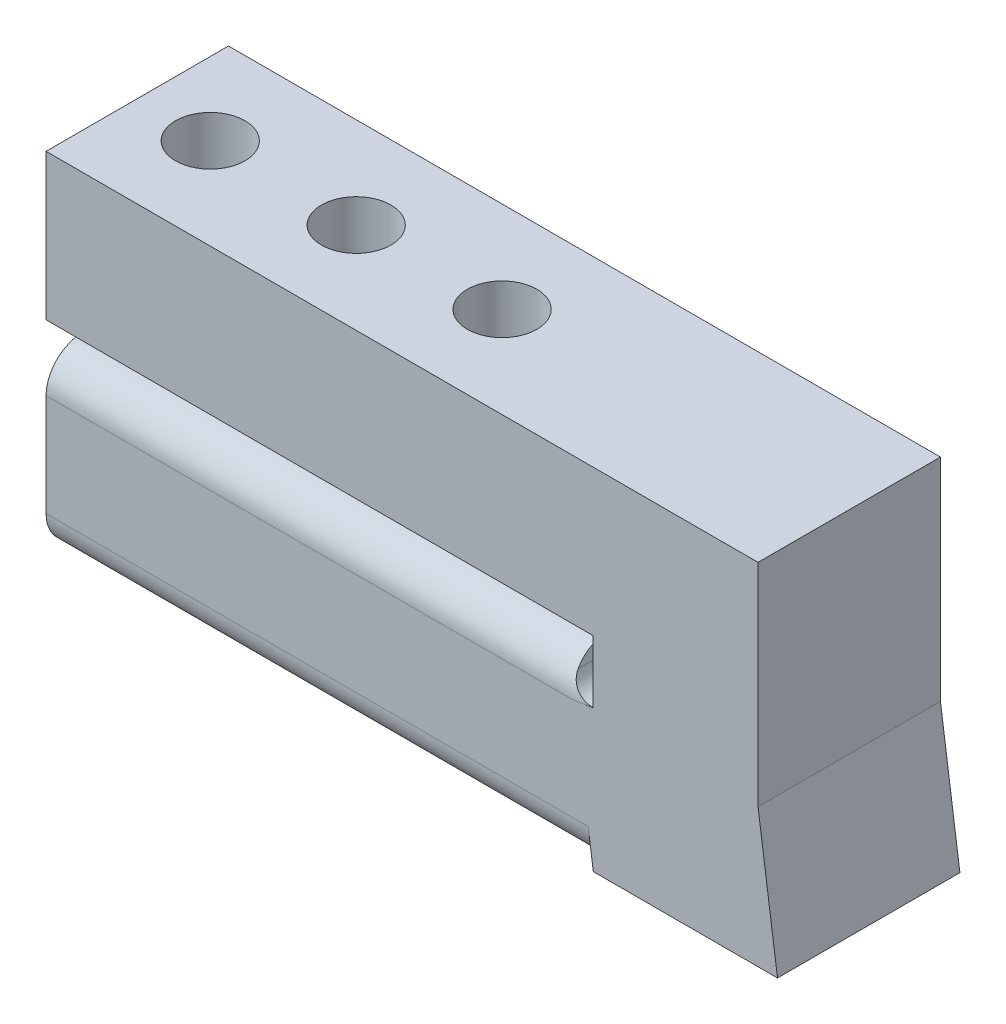
from build123d import *

# Parameters (mm, degrees)
SKETCH1_W                = 50
SKETCH1_H                = 25
BOSS_EXTRUDE1_DEPTH      = 25
BOSS_EXTRUDE2_DEPTH      = 25
SKETCH4_R                = 6.625
CUT_EXTRUDE1_DEPTH       = 75
SKETCH9_R                = 3.1
CUT_EXTRUDE6_DEPTH       = 116.938210964
FILLET3_R                = 5
FILLET5_R                = 3
SKETCH10_W               = 47.732743957
SKETCH10_H               = 107.667843513
CUT_EXTRUDE7_DEPTH       = 100
SKETCH11_W               = 28.236029243
SKETCH11_H               = 25
CUT_EXTRUDE8_DEPTH       = 111.285013225
SKETCH12_W               = 27.477268163
SKETCH12_H               = 27.699456316
CUT_EXTRUDE9_DEPTH       = 5
BODY_MOVE_COPY1_ANGLE    = 8
SKETCH13_W               = 22.608001889
SKETCH13_H               = 25
BOSS_EXTRUDE3_DEPTH      = 29
SKETCH14_W               = 25
SKETCH14_H               = 20
BOSS_EXTRUDE4_DEPTH      = 74.967411564
CUT_EXTRUDE10_DEPTH      = 113.041997451
CUT_EXTRUDE10_DEPTH_BACK = 113.041997451
SKETCH15_R               = 4.7625
SKETCH15_R_2             = 3.1


with BuildPart() as part:
    # Sketch1 → Boss-Extrude1 (new body)
    with BuildSketch(Plane.XY):
        Rectangle(SKETCH1_W, SKETCH1_H)
    extrude(amount=BOSS_EXTRUDE1_DEPTH)

    # Sketch3 → Boss-Extrude2 (add)
    with BuildSketch(Plane.XY.offset(25)):
        Polygon((-25, 12.5), (-99.270105156, 22.937982572), (-95.929950733, 46.704416222), (-25, 36.73586174), (-25, 31.73586174), (25, 31.73586174), (25, 36.73586174), (95.929950733, 46.704416222), (99.270105156, 22.937982572), (25, 12.5), align=None)
    extrude(amount=-BOSS_EXTRUDE2_DEPTH)

    # Sketch4 → Cut-Extrude1 (cut)
    with BuildSketch(Plane(origin=(-100.508609829, 14.12556392, 0), x_dir=(0, 0, 1), z_dir=(-0.9902680687415705, 0.13917310096006502, 0))):
        with Locations(Location((12.5, 20.899023335, 0), (0, 0, 270))):
            Circle(SKETCH4_R)
    cut_extrude1 = extrude(amount=-CUT_EXTRUDE1_DEPTH, mode=Mode.SUBTRACT)

    # Mirror1: Cut-Extrude1 across plane
    add(cut_extrude1.mirror(Plane(origin=(0, 0, 0), x_dir=(0, 0, 1), z_dir=(1, 0, 0))), mode=Mode.SUBTRACT)

    # Sketch9 → Cut-Extrude6 (cut, through all)
    with BuildSketch(Plane(origin=(4.578659096, 32.578852302, 0), x_dir=(0.9902680687415703, -0.1391731009600656, 0), z_dir=(0.1391731009600656, 0.9902680687415703, 0))):
        with Locations(Location((-91.496365481, -12.5, 0), (0, 0, 180))):
            Circle(SKETCH9_R)
        with Locations(Location((-71.496365481, -12.5, 0), (0, 0, 180))):
            Circle(SKETCH9_R)
        with Locations(Location((-51.496365481, -12.5, 0), (0, 0, 180))):
            Circle(SKETCH9_R)
    extrude(amount=-CUT_EXTRUDE6_DEPTH, mode=Mode.SUBTRACT)

    # Fillet3
    # the kernel refuses this fillet: 5 mm, written as the material it takes off along each edge
    with BuildSketch(Plane(origin=(111.648456015, 24.677646334, 25), x_dir=(-0.13917310096006577, 0.9902680687415704, 0), z_dir=(-0.9902680687415703, -0.13917310096006574, 0))) as fillet3_piece_1_section:
        with BuildLine():
            CenterArc((FILLET3_R, FILLET3_R), FILLET3_R, 180, 90)
            Line((0, FILLET3_R), (0, 0))
            Line((0, 0), (FILLET3_R, 0))
        make_face()
    fillet3_piece_1 = extrude(amount=100, mode=Mode.PRIVATE)
    fillet3_piece_1 = split(fillet3_piece_1, bisect_by=Plane(origin=(25, 18.834233779, 23.882189323), z_dir=(1, 0, 0)), keep=Keep.TOP, mode=Mode.PRIVATE)
    add(fillet3_piece_1, mode=Mode.SUBTRACT)
    with BuildSketch(Plane(origin=(12.621649141, 34.996197978, 25), x_dir=(0.13917310096006597, -0.9902680687415704, 0), z_dir=(0.9902680687415703, 0.13917310096006597, 0))) as fillet3_piece_2_section:
        with BuildLine():
            CenterArc((FILLET3_R, FILLET3_R), FILLET3_R, 180, 90)
            Line((0, FILLET3_R), (0, 0))
            Line((0, 0), (FILLET3_R, 0))
        make_face()
    fillet3_piece_2 = extrude(amount=96.627019967, mode=Mode.PRIVATE)
    fillet3_piece_2 = split(fillet3_piece_2, bisect_by=Plane(origin=(60.542812169, 31.73586174, 23.884172665), z_dir=(0, 1, 0)), keep=Keep.TOP, mode=Mode.PRIVATE)
    add(fillet3_piece_2, mode=Mode.SUBTRACT)
    with BuildSketch(Plane(origin=(-108.308301592, 48.444079984, 25), x_dir=(-0.13917310096006566, -0.9902680687415704, 0), z_dir=(0.9902680687415704, -0.13917310096006566, 0))) as fillet3_piece_3_section:
        with BuildLine():
            CenterArc((FILLET3_R, FILLET3_R), FILLET3_R, 180, 90)
            Line((0, FILLET3_R), (0, 0))
            Line((0, 0), (FILLET3_R, 0))
        make_face()
    fillet3_piece_3 = extrude(amount=96.627019967, mode=Mode.PRIVATE)
    fillet3_piece_3 = split(fillet3_piece_3, bisect_by=Plane(origin=(-60.542812169, 31.73586174, 23.884172665), z_dir=(0, 1, 0)), keep=Keep.TOP, mode=Mode.PRIVATE)
    add(fillet3_piece_3, mode=Mode.SUBTRACT)
    with BuildSketch(Plane(origin=(-12.621649141, 10.760336238, 25), x_dir=(0.13917310096006563, 0.9902680687415704, 0), z_dir=(-0.9902680687415703, 0.13917310096006563, 0))) as fillet3_piece_4_section:
        with BuildLine():
            CenterArc((FILLET3_R, FILLET3_R), FILLET3_R, 180, 90)
            Line((0, FILLET3_R), (0, 0))
            Line((0, 0), (FILLET3_R, 0))
        make_face()
    fillet3_piece_4 = extrude(amount=100, mode=Mode.PRIVATE)
    fillet3_piece_4 = split(fillet3_piece_4, bisect_by=Plane(origin=(-25, 18.834233779, 23.882189323), z_dir=(-1, 0, 0)), keep=Keep.TOP, mode=Mode.PRIVATE)
    add(fillet3_piece_4, mode=Mode.SUBTRACT)
    with BuildSketch(Plane(origin=(111.648456015, 24.677646334, 0), x_dir=(-0.13917310096006577, 0.9902680687415704, 0), z_dir=(-0.9902680687415703, -0.13917310096006574, 0))) as fillet3_piece_5_section:
        with BuildLine():
            CenterArc((FILLET3_R, -FILLET3_R), FILLET3_R, 90, 90)
            Line((0, -FILLET3_R), (0, 0))
            Line((0, 0), (FILLET3_R, 0))
        make_face()
    fillet3_piece_5 = extrude(amount=100, mode=Mode.PRIVATE)
    fillet3_piece_5 = split(fillet3_piece_5, bisect_by=Plane(origin=(25, 18.834233779, 1.117810677), z_dir=(1, 0, 0)), keep=Keep.TOP, mode=Mode.PRIVATE)
    add(fillet3_piece_5, mode=Mode.SUBTRACT)
    with BuildSketch(Plane(origin=(12.621649141, 34.996197978, 0), x_dir=(0.13917310096006597, -0.9902680687415704, 0), z_dir=(0.9902680687415703, 0.13917310096006597, 0))) as fillet3_piece_6_section:
        with BuildLine():
            CenterArc((FILLET3_R, -FILLET3_R), FILLET3_R, 90, 90)
            Line((0, -FILLET3_R), (0, 0))
            Line((0, 0), (FILLET3_R, 0))
        make_face()
    fillet3_piece_6 = extrude(amount=96.627019967, mode=Mode.PRIVATE)
    fillet3_piece_6 = split(fillet3_piece_6, bisect_by=Plane(origin=(60.542812169, 31.73586174, 1.115827335), z_dir=(0, 1, 0)), keep=Keep.TOP, mode=Mode.PRIVATE)
    add(fillet3_piece_6, mode=Mode.SUBTRACT)
    with BuildSketch(Plane(origin=(-108.308301592, 48.444079984, 0), x_dir=(-0.13917310096006566, -0.9902680687415704, 0), z_dir=(0.9902680687415704, -0.13917310096006566, 0))) as fillet3_piece_7_section:
        with BuildLine():
            CenterArc((FILLET3_R, -FILLET3_R), FILLET3_R, 90, 90)
            Line((0, -FILLET3_R), (0, 0))
            Line((0, 0), (FILLET3_R, 0))
        make_face()
    fillet3_piece_7 = extrude(amount=96.627019967, mode=Mode.PRIVATE)
    fillet3_piece_7 = split(fillet3_piece_7, bisect_by=Plane(origin=(-60.542812169, 31.73586174, 1.115827335), z_dir=(0, 1, 0)), keep=Keep.TOP, mode=Mode.PRIVATE)
    add(fillet3_piece_7, mode=Mode.SUBTRACT)
    with BuildSketch(Plane(origin=(-12.621649141, 10.760336238, 0), x_dir=(0.13917310096006563, 0.9902680687415704, 0), z_dir=(-0.9902680687415703, 0.13917310096006563, 0))) as fillet3_piece_8_section:
        with BuildLine():
            CenterArc((FILLET3_R, -FILLET3_R), FILLET3_R, 90, 90)
            Line((0, -FILLET3_R), (0, 0))
            Line((0, 0), (FILLET3_R, 0))
        make_face()
    fillet3_piece_8 = extrude(amount=100, mode=Mode.PRIVATE)
    fillet3_piece_8 = split(fillet3_piece_8, bisect_by=Plane(origin=(-25, 18.834233779, 1.117810677), z_dir=(-1, 0, 0)), keep=Keep.TOP, mode=Mode.PRIVATE)
    add(fillet3_piece_8, mode=Mode.SUBTRACT)

    # Fillet5
    fillet5_edges = [part.edges().sort_by_distance(p)[0] for p in [
        (25, 31.73586174, 12.5),
        (-25, 31.73586174, 12.5),
    ]]
    fillet(fillet5_edges, radius=FILLET5_R)

    # Sketch10 → Cut-Extrude7 (cut)
    with BuildSketch(Plane(origin=(0, 0, 0), x_dir=(0, 0, -1), z_dir=(1, 0, 0))):
        with Locations((-11.782214376, 4.002620484)):
            Rectangle(SKETCH10_W, SKETCH10_H)
    extrude(amount=CUT_EXTRUDE7_DEPTH, mode=Mode.SUBTRACT)

    # Sketch11 → Cut-Extrude8 (cut, through all)
    with BuildSketch(Plane(origin=(1.238504673, 8.812418652, 0), x_dir=(0.9902680687415703, -0.13917310096006563, 0), z_dir=(-0.13917310096006563, -0.9902680687415703, 0))):
        with Locations((-12.37835086, 12.5)):
            Rectangle(SKETCH11_W, SKETCH11_H)
    extrude(amount=CUT_EXTRUDE8_DEPTH, mode=Mode.SUBTRACT)

    # Sketch12 → Cut-Extrude9 (cut)
    with BuildSketch(Plane(origin=(4.578659096, 32.578852302, 0), x_dir=(0.9902680687415703, -0.1391731009600656, 0), z_dir=(0.1391731009600656, 0.9902680687415703, 0))):
        with Locations((-12.790319835, -12.604422979)):
            Rectangle(SKETCH12_W, SKETCH12_H)
    extrude(amount=-CUT_EXTRUDE9_DEPTH, mode=Mode.SUBTRACT)


with BuildPart() as part_1:
    # Body-Move/Copy1: moved
    add(part.part.rotate(Axis((-49.635052578, 27.845447677, 0), (0, 0, 1)), BODY_MOVE_COPY1_ANGLE))

    # Sketch13 → Boss-Extrude3 (add)
    with BuildSketch(Plane(origin=(0, 35.077877501, 0), x_dir=(1, 0, 0), z_dir=(0, 1, 0))):
        with Locations((-11.832660591, -12.5)):
            Rectangle(SKETCH13_W, SKETCH13_H)
    extrude(amount=BOSS_EXTRUDE3_DEPTH)

    # Sketch14 → Boss-Extrude4 (add)
    with BuildSketch(Plane.ZY.offset(23.136661535)):
        with Locations((12.5, 54.077877501)):
            Rectangle(SKETCH14_W, SKETCH14_H)
    extrude(amount=BOSS_EXTRUDE4_DEPTH)

    # Sketch15 → Cut-Extrude10 (cut, two sides: drawn at the far end of the back side and taken through both)
    # profile 1 of 6: a face of its own
    with BuildSketch(Plane(origin=(0, 64.077877501, 0), x_dir=(1, 0, 0), z_dir=(0, 1, 0)).offset(-CUT_EXTRUDE10_DEPTH_BACK)):
        with Locations(Location((-88.104073099, -12.5, 0), (0, 0, 270))):
            Circle(SKETCH15_R)
        with Locations((-88.104073099, -12.5)):
            Circle(SKETCH15_R_2, mode=Mode.SUBTRACT)
    # profile 2 of 6: a face of its own
    with BuildSketch(Plane(origin=(0, 64.077877501, 0), x_dir=(1, 0, 0), z_dir=(0, 1, 0)).offset(-CUT_EXTRUDE10_DEPTH_BACK)):
        with Locations((-88.104073099, -12.5)):
            Circle(SKETCH15_R_2)
    # profile 3 of 6: a face of its own
    with BuildSketch(Plane(origin=(0, 64.077877501, 0), x_dir=(1, 0, 0), z_dir=(0, 1, 0)).offset(-CUT_EXTRUDE10_DEPTH_BACK)):
        with Locations(Location((-68.104073099, -12.5, 0), (0, 0, 270))):
            Circle(SKETCH15_R)
        with Locations((-68.104073099, -12.5)):
            Circle(SKETCH15_R_2, mode=Mode.SUBTRACT)
    # profile 4 of 6: a face of its own
    with BuildSketch(Plane(origin=(0, 64.077877501, 0), x_dir=(1, 0, 0), z_dir=(0, 1, 0)).offset(-CUT_EXTRUDE10_DEPTH_BACK)):
        with Locations((-68.104073099, -12.5)):
            Circle(SKETCH15_R_2)
    # profile 5 of 6: a face of its own
    with BuildSketch(Plane(origin=(0, 64.077877501, 0), x_dir=(1, 0, 0), z_dir=(0, 1, 0)).offset(-CUT_EXTRUDE10_DEPTH_BACK)):
        with Locations(Location((-48.104073099, -12.5, 0), (0, 0, 270))):
            Circle(SKETCH15_R)
        with Locations((-48.104073099, -12.5)):
            Circle(SKETCH15_R_2, mode=Mode.SUBTRACT)
    # profile 6 of 6: a face of its own
    with BuildSketch(Plane(origin=(0, 64.077877501, 0), x_dir=(1, 0, 0), z_dir=(0, 1, 0)).offset(-CUT_EXTRUDE10_DEPTH_BACK)):
        with Locations((-48.104073099, -12.5)):
            Circle(SKETCH15_R_2)
    extrude(amount=CUT_EXTRUDE10_DEPTH + CUT_EXTRUDE10_DEPTH_BACK, mode=Mode.SUBTRACT)


solid = part_1.part
